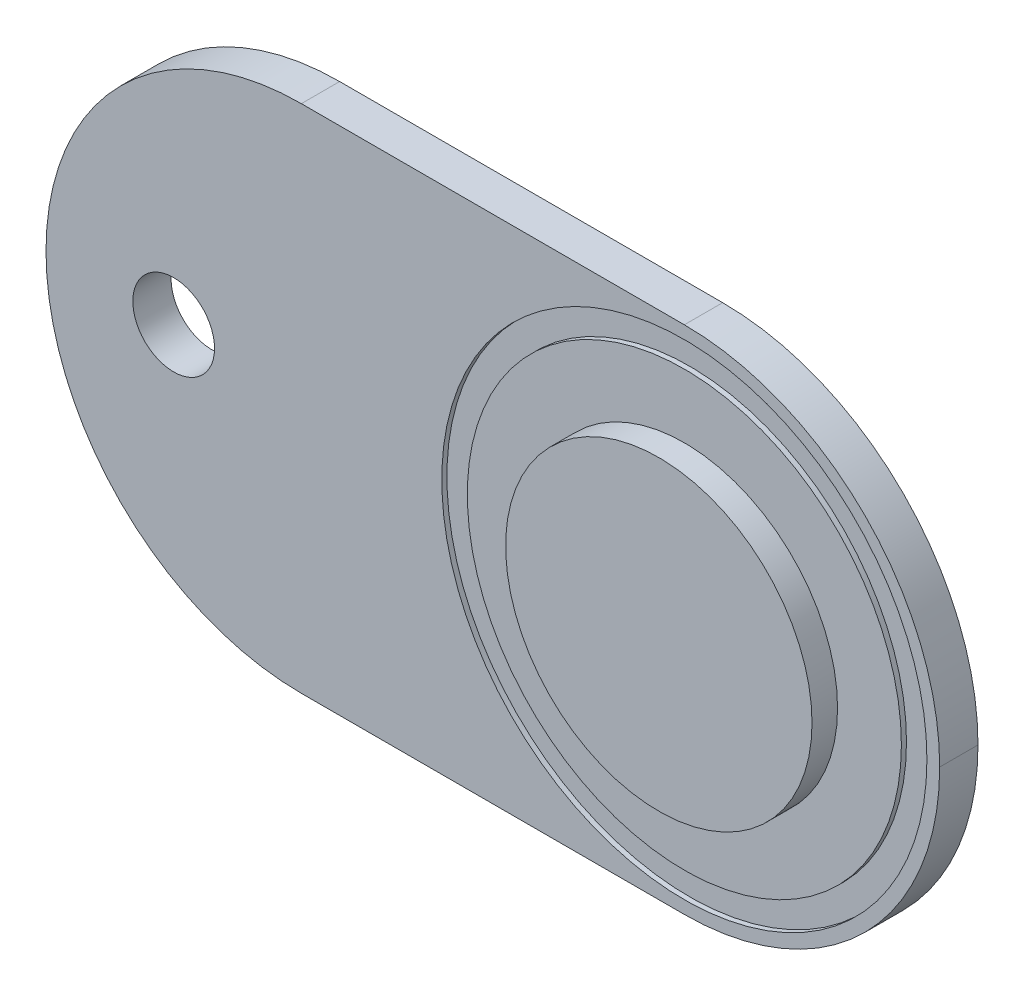
from build123d import *

# Parameters (mm, degrees)
SKETCH1_W               = 35
SKETCH1_H               = 20
BOSS_EXTRUDE1_DEPTH     = 1.5
SKETCH2_R               = 1.6
CUT_M3_HOLE_DEPTH       = 37.431442464
SKETCH3_R               = 6
BOSS_FSR_BOSS_DEPTH     = 1
FILLET1_R               = 10
SKETCH4_R               = 9.5
SKETCH4_R_2             = 8.5
CUT_EXTRUDE_THIN1_DEPTH = 0.2


with BuildPart() as part:
    # Sketch1 → Boss-Extrude1 (new body)
    with BuildSketch(Plane.XY):
        with Locations((17.5, 0)):
            Rectangle(SKETCH1_W, SKETCH1_H)
    extrude(amount=BOSS_EXTRUDE1_DEPTH)

    # Sketch2 → Cut-M3 Hole (cut, through all)
    with BuildSketch(Plane.XY.offset(1.5)):
        with Locations((5, 0)):
            Circle(SKETCH2_R)
    extrude(amount=-CUT_M3_HOLE_DEPTH, mode=Mode.SUBTRACT)

    # Sketch3 → Boss-FSR Boss (add)
    with BuildSketch(Plane.XY.offset(1.5)):
        with Locations((25, 0)):
            Circle(SKETCH3_R)
    extrude(amount=BOSS_FSR_BOSS_DEPTH)

    # Fillet1
    fillet1_edges = [part.edges().sort_by_distance(p)[0] for p in [
        (0, 10, 0.75),
        (35, 10, 0.75),
        (35, -10, 0.75),
        (0, -10, 0.75),
    ]]
    fillet(fillet1_edges, radius=FILLET1_R - 0.0001)  # a hair under: the kernel refuses the full size

    # Sketch4 → Cut-Extrude-Thin1 (cut)
    with BuildSketch(Plane.XY.offset(1.5)):
        with Locations((25, 0)):
            Circle(SKETCH4_R)
        with Locations((25, 0)):
            Circle(SKETCH4_R_2, mode=Mode.SUBTRACT)
    extrude(amount=-CUT_EXTRUDE_THIN1_DEPTH, mode=Mode.SUBTRACT)


solid = part.part
